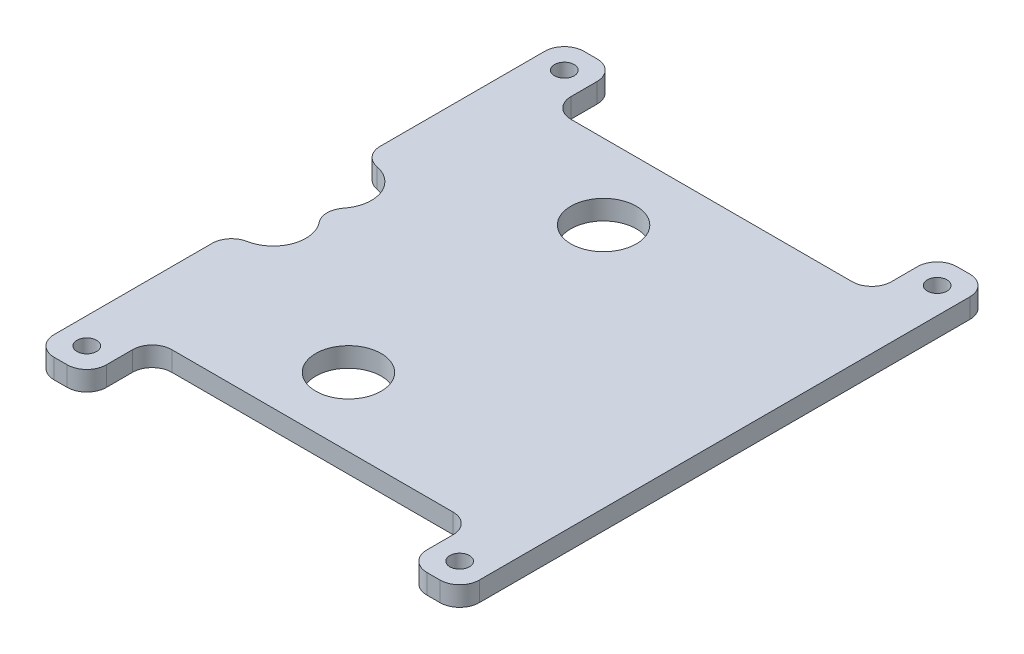
from build123d import *

# Parameters (mm, degrees)
SKETCH1_R           = 5
SKETCH1_R_2         = 1.5
BOSS_EXTRUDE1_DEPTH = 3
FILLET1_R           = 3


with BuildPart() as part:
    # Sketch1 → Boss-Extrude1 (new body)
    with BuildSketch(Plane(origin=(0, 0, 0), x_dir=(1, 0, 0), z_dir=(0, 1, 0))):
        with BuildLine():
            Line((10.905619524, 39.769696007), (10.905619524, 61))
            Line((10.905619524, 61), (10.905619524, 71))
            Line((10.905619524, 71), (18.905619524, 71))
            Line((18.905619524, 71), (18.905619524, 61))
            Line((18.905619524, 61), (67.905619524, 61))
            Line((67.905619524, 61), (67.905619524, 71))
            Line((67.905619524, 71), (75.905619524, 71))
            Line((75.905619524, 71), (75.905619524, 61))
            Line((75.905619524, 61), (75.905619524, 0))
            Line((75.905619524, 0), (75.905619524, -10))
            Line((75.905619524, -10), (67.905619524, -10))
            Line((67.905619524, -10), (67.905619524, 0))
            Line((67.905619524, 0), (18.905619524, 0))
            Line((18.905619524, 0), (18.905619524, -10))
            Line((18.905619524, -10), (10.905619524, -10))
            Line((10.905619524, -10), (10.905619524, 0))
            Line((10.905619524, 0), (10.905619524, 20.230303993))
            ThreePointArc((10.905619524, 20.230303993), (17.347708153, 24.241211504), (12.405619524, 30))
            ThreePointArc((12.405619524, 30), (17.347708153, 35.758788496), (10.905619524, 39.769696007))
        make_face()
        with Locations((38.405619524, 10.5)):
            Circle(SKETCH1_R, mode=Mode.SUBTRACT)
        with Locations((38.405619524, 49.5)):
            Circle(SKETCH1_R, mode=Mode.SUBTRACT)
        with Locations((14.905619524, -6)):
            Circle(SKETCH1_R_2, mode=Mode.SUBTRACT)
        with Locations((14.905619524, 67)):
            Circle(SKETCH1_R_2, mode=Mode.SUBTRACT)
        with Locations((71.905619524, -6)):
            Circle(SKETCH1_R_2, mode=Mode.SUBTRACT)
        with Locations((71.905619524, 67)):
            Circle(SKETCH1_R_2, mode=Mode.SUBTRACT)
    extrude(amount=BOSS_EXTRUDE1_DEPTH)

    # Fillet1
    fillet1_edges = [part.edges().sort_by_distance(p)[0] for p in [
        (75.905619524, 1.5, 10),
        (67.905619524, 1.5, 10),
        (67.905619524, 1.5, 0),
        (18.905619524, 1.5, 0),
        (18.905619524, 1.5, 10),
        (10.905619524, 1.5, 10),
        (10.905619524, 1.5, -20.230303993),
        (12.405619524, 1.5, -30),
        (10.905619524, 1.5, -39.769696007),
        (10.905619524, 1.5, -71),
        (18.905619524, 1.5, -71),
        (18.905619524, 1.5, -61),
        (67.905619524, 1.5, -61),
        (67.905619524, 1.5, -71),
        (75.905619524, 1.5, -71),
    ]]
    fillet(fillet1_edges, radius=FILLET1_R)


solid = part.part
